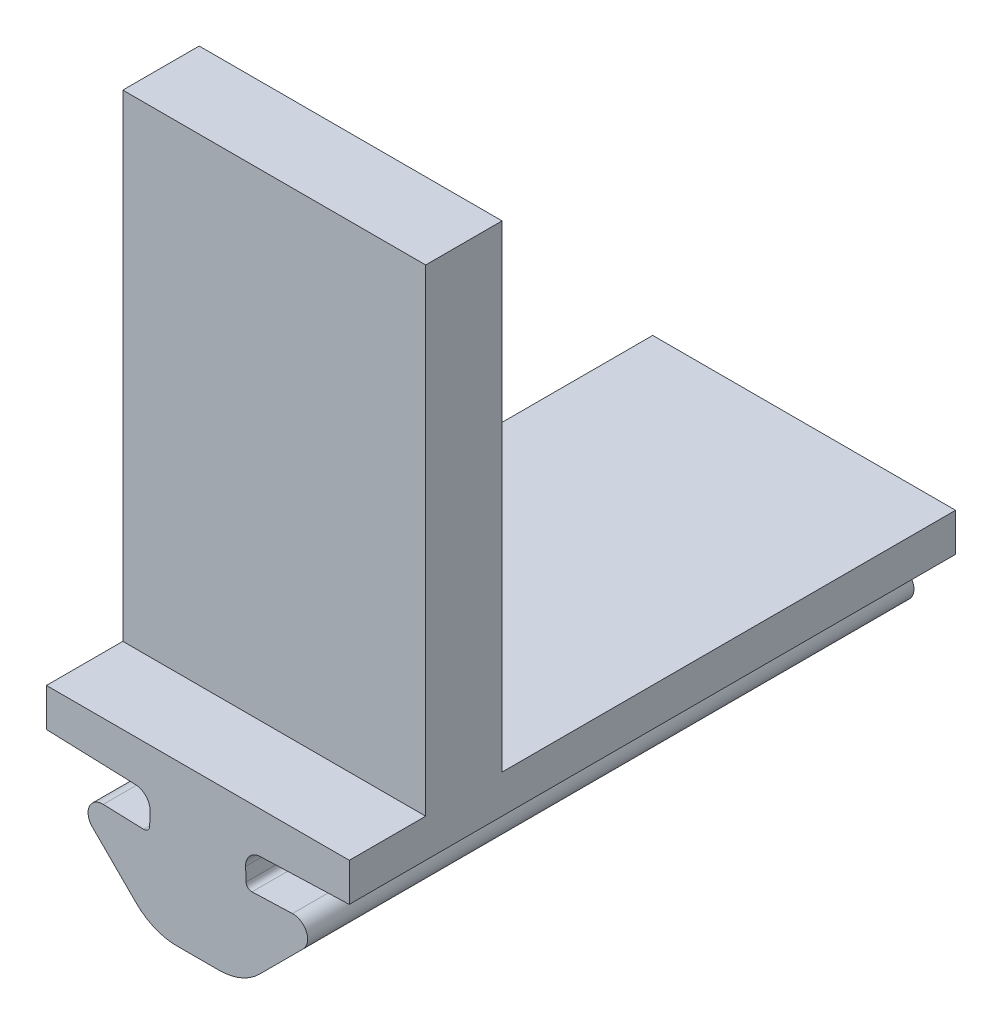
from build123d import *

# Parameters (mm, degrees)
BOSS_EXTRUDE1_DEPTH = 31.75
SKETCH19_W          = 15.860402013
SKETCH19_H          = 31.75
BOSS_EXTRUDE7_DEPTH = 2
SKETCH23_W          = 15.860402013
SKETCH23_H          = 4
BOSS_EXTRUDE8_DEPTH = 25
SKETCH24_R          = 1.25
CUT_EXTRUDE1_DEPTH  = 2.54


with BuildPart() as part:
    # Sketch2 → Boss-Extrude1 (new body)
    with BuildSketch(Plane.XY):
        with BuildLine():
            Line((-50.375618534, 45.609862895), (-50.351188886, 46.309436474))
            ThreePointArc((-50.351188886, 46.309436474), (-50.565618587, 46.88295476), (-51.12278195, 47.136868733))
            Line((-51.12278195, 47.136868733), (-55.780902554, 47.299533889))
            Line((-55.780902554, 47.299533889), (-47.850701548, 47.299533889))
            Line((-47.850701548, 47.299533889), (-47.850701548, 40.900752235))
            Line((-47.850701548, 40.900752235), (-48.952946324, 40.900752235))
            ThreePointArc((-48.952946324, 40.900752235), (-50.100996621, 41.129113637), (-51.074266668, 41.779431891))
            Line((-51.074266668, 41.779431891), (-53.375146928, 44.080312152))
            ThreePointArc((-53.375146928, 44.080312152), (-53.536830204, 44.931922499), (-52.803734096, 45.394471696))
            Line((-52.803734096, 45.394471696), (-50.685905631, 45.320515496))
            ThreePointArc((-50.685905631, 45.320515496), (-50.470836274, 45.400926634), (-50.375618534, 45.609862895))
        make_face()
    boss_extrude1 = extrude(amount=BOSS_EXTRUDE1_DEPTH)

    # Mirror2: Boss-Extrude1 across plane
    add(boss_extrude1.mirror(Plane(origin=(-47.850701548, 40.900752235, 31.75), x_dir=(0, 0, 1), z_dir=(-1, 0, 0))))

    # Sketch19 → Boss-Extrude7 (add)
    with BuildSketch(Plane(origin=(0, 47.299533889, 0), x_dir=(1, 0, 0), z_dir=(0, 1, 0))):
        with Locations((-47.850701548, -15.875)):
            Rectangle(SKETCH19_W, SKETCH19_H)
    extrude(amount=BOSS_EXTRUDE7_DEPTH)

    # Sketch23 → Boss-Extrude8 (add)
    with BuildSketch(Plane(origin=(0, 49.299533889, 0), x_dir=(1, 0, 0), z_dir=(0, 1, 0))):
        with Locations((-47.850701548, -25.75)):
            Rectangle(SKETCH23_W, SKETCH23_H)
    extrude(amount=BOSS_EXTRUDE8_DEPTH)

    # Sketch24 → Cut-Extrude1 (cut)
    with BuildSketch(Plane(origin=(0, 0, 23.75), x_dir=(-1, 0, 0), z_dir=(0, 0, -1))):
        with Locations((49.176902554, 69.299533889)):
            Circle(SKETCH24_R)
    extrude(amount=-CUT_EXTRUDE1_DEPTH, mode=Mode.SUBTRACT)


solid = part.part
